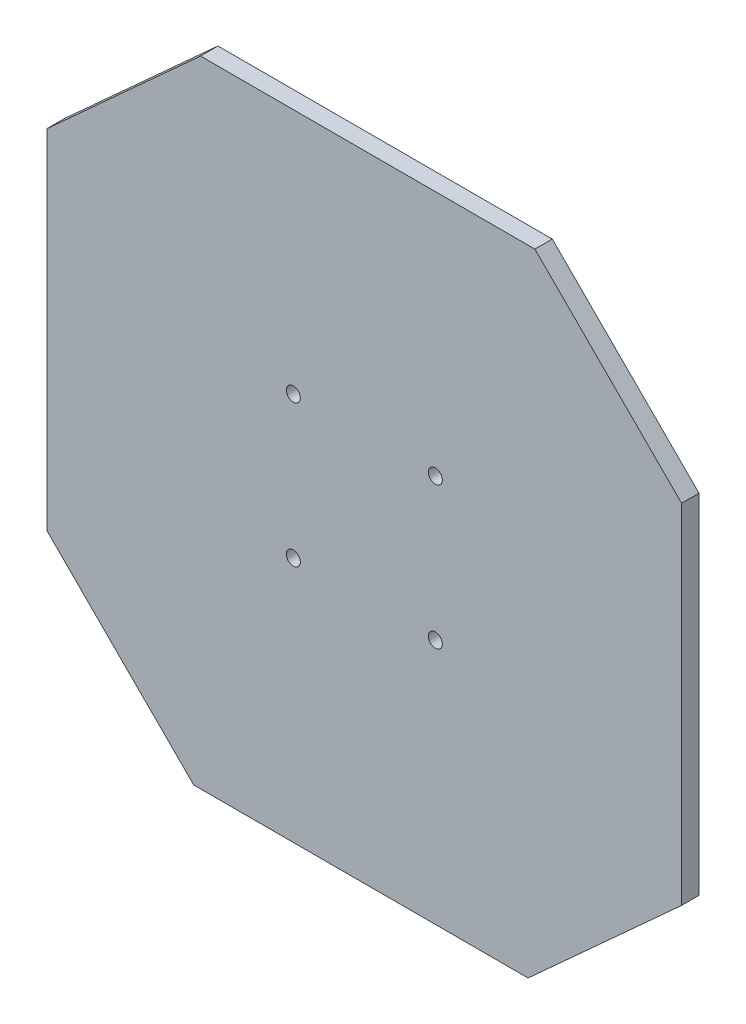
from build123d import *

# Parameters (mm, degrees)
BOSS_EXTRUDE1_DEPTH = 2.6
CAVITY1_OUTLINE_R   = 1.05
CAVITY1_DEPTH       = 2.6


# Read off the part's stored shape, not the designer's step: Cavity1
with BuildPart() as part:
    # Sketch1 → Boss-Extrude1 (new body)
    with BuildSketch(Plane.XY):
        Polygon((20.678672923, 94.689954591), (-2.25890757, 73.836480034), (-2.25890757, 21.810264808), (19.661402647, -0.110045409), (69.603511937, -0.110045409), (92.54109243, 20.743429149), (92.54109243, 72.769644374), (70.620782213, 94.689954591), align=None)
    extrude(amount=BOSS_EXTRUDE1_DEPTH)

    # Cavity1 outline → Cavity1 (cut)
    with BuildSketch(Plane.XY):
        with Locations((34.534490712, 57.896556309)):
            Circle(CAVITY1_OUTLINE_R)
        with Locations((34.534490712, 36.683352873)):
            Circle(CAVITY1_OUTLINE_R)
        with Locations((55.747694148, 57.896556309)):
            Circle(CAVITY1_OUTLINE_R)
        with Locations((55.747694148, 36.683352873)):
            Circle(CAVITY1_OUTLINE_R)
    extrude(amount=CAVITY1_DEPTH, mode=Mode.SUBTRACT)


solid = part.part
